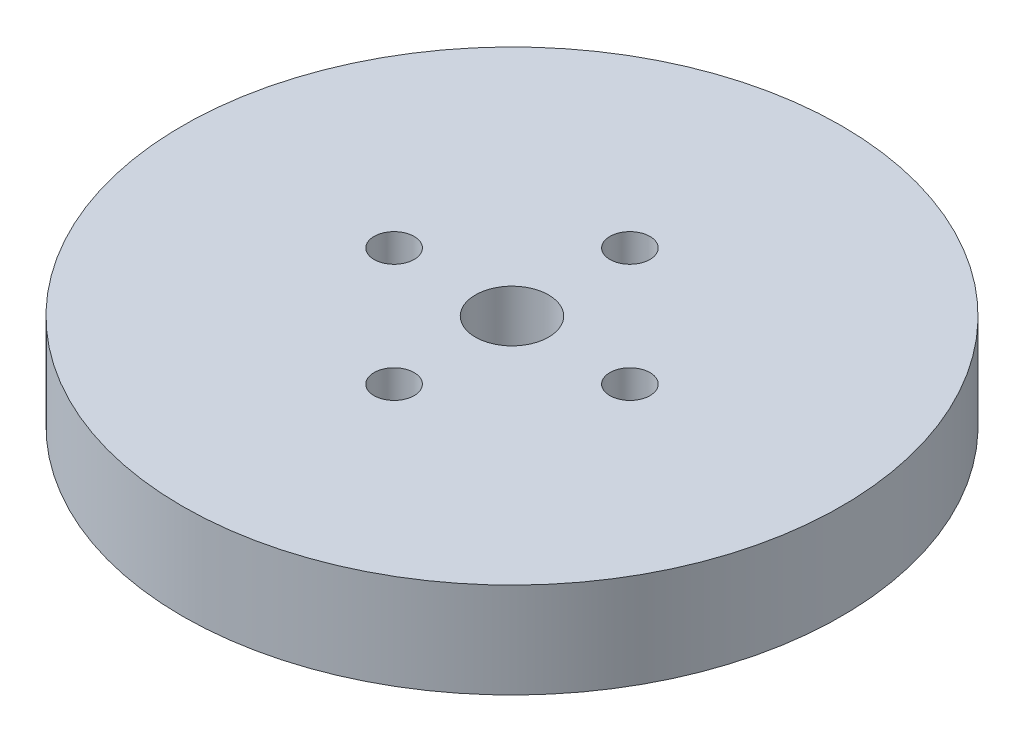
from build123d import *

# Parameters (mm, degrees)
SKETCH1_R           = 90
BOSS_EXTRUDE1_DEPTH = 26
SKETCH2_R           = 10
CUT_EXTRUDE1_DEPTH  = 130.907659512
SKETCH3_R           = 5.470803328
CUT_EXTRUDE2_DEPTH  = 19.156883318
CIRPATTERN1_COUNT   = 4


with BuildPart() as part:
    # Sketch1 → Boss-Extrude1 (new body)
    with BuildSketch(Plane(origin=(0, 0, 0), x_dir=(1, 0, 0), z_dir=(0, 1, 0))):
        Circle(SKETCH1_R)
    extrude(amount=BOSS_EXTRUDE1_DEPTH)

    # Sketch2 → Cut-Extrude1 (cut, through all)
    with BuildSketch(Plane(origin=(0, 0, 0), x_dir=(1, 0, 0), z_dir=(0, 1, 0))):
        Circle(SKETCH2_R)
    extrude(amount=CUT_EXTRUDE1_DEPTH, mode=Mode.SUBTRACT)

    # Sketch3 → Cut-Extrude2 (cut)
    with BuildSketch(Plane(origin=(0, 26, 0), x_dir=(1, 0, 0), z_dir=(0, 1, 0))):
        with Locations((-32.201291548, 0)):
            Circle(SKETCH3_R)
    cut_extrude2 = extrude(amount=-CUT_EXTRUDE2_DEPTH, mode=Mode.SUBTRACT)

    # CirPattern1: Cut-Extrude2 ×4 about axis
    cirpattern1_axis = Axis((0, 0, 0), (0, 1, 0))
    for i in range(1, CIRPATTERN1_COUNT):
        add(cut_extrude2.rotate(cirpattern1_axis, i * 360 / CIRPATTERN1_COUNT), mode=Mode.SUBTRACT)


solid = part.part
